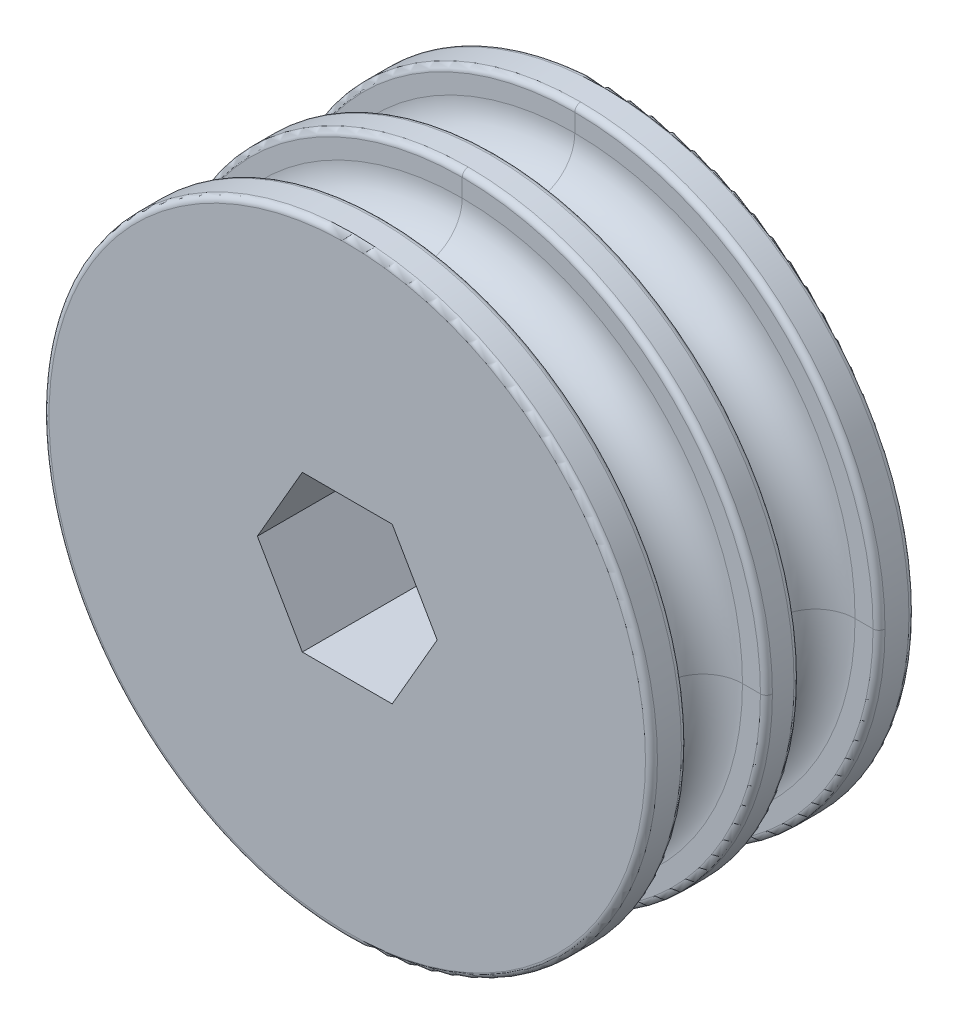
from build123d import *

# Parameters (mm, degrees)
SKETCH1_R           = 25.4
BOSS_EXTRUDE1_DEPTH = 11
FILLET1_R           = 0.5


with BuildPart() as part:
    # Sketch1 → Boss-Extrude1 (new, symmetric)
    with BuildSketch(Plane.XY):
        Circle(SKETCH1_R)
        Polygon((3.75277675, -6.5), (7.505553499, 0), (3.75277675, 6.5), (-3.75277675, 6.5), (-7.505553499, 0), (-3.75277675, -6.5), align=None, mode=Mode.SUBTRACT)
    extrude(amount=BOSS_EXTRUDE1_DEPTH, both=True)

    # Cut-Sweep1: sweep along a curve in space
    with BuildLine() as cut_sweep1_path:
        ThreePointArc((25.4, 0, -11), (17.960512242, 17.960512242, -11), (0, 25.4, -11))
        ThreePointArc((0, 25.4, -11), (-17.960512242, 17.960512242, -11), (-25.4, 0, -11))
        ThreePointArc((-25.4, 0, -11), (-17.960512242, -17.960512242, -11), (0, -25.4, -11))
        ThreePointArc((0, -25.4, -11), (17.960512242, -17.960512242, -11), (25.4, 0, -11))
    # Sketch2 → Cut-Sweep1 (sweep, cut)
    with BuildSketch(Plane(origin=(0, 0, 0), x_dir=(0, 0, -1), z_dir=(1, 0, 0))):
        with BuildLine():
            Line((8, 23.4), (8, 25.4))
            Line((8, 25.4), (1.4, 25.4))
            Line((1.4, 25.4), (1.4, 23.4))
            ThreePointArc((1.4, 23.4), (4.7, 20.1), (8, 23.4))
        make_face()
    cut_sweep1 = sweep(path=cut_sweep1_path.line, mode=Mode.SUBTRACT)

    # Mirror1: Cut-Sweep1 across plane
    add(cut_sweep1.mirror(Plane.XY), mode=Mode.SUBTRACT)

    # Fillet1
    fillet1_edges = [part.edges().sort_by_distance(p)[0] for p in [
        (-25.4, 0, 11),
        (-25.4, 0, -11),
        (-25.4, 0, -8),
        (-25.4, 0, -8),
        (-25.4, 0, 8),
        (-25.4, 0, 8),
        (-25.4, 0, 1.4),
        (-25.4, 0, 1.4),
        (-25.4, 0, -1.4),
        (-25.4, 0, -1.4),
    ]]
    fillet(fillet1_edges, radius=FILLET1_R)


solid = part.part
